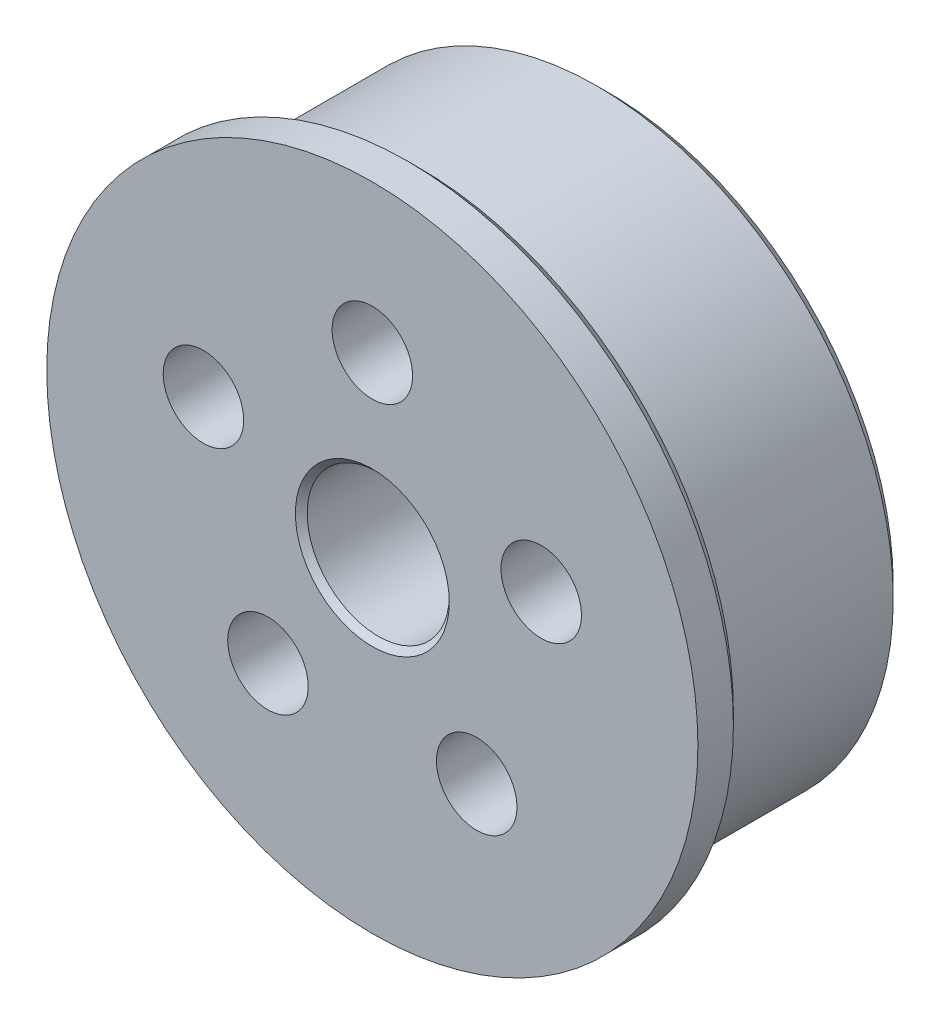
from build123d import *

# Parameters (mm, degrees)
SKETCH_1_R                   = 12.5
SKETCH_1_R_2                 = 1.5
EXTRUDE_1_DEPTH              = 10
EXTRUDE_START                = -2
SKETCH_3_R                   = 13.75
SKETCH_3_R_2                 = 12.5
EXTRUDE_3_DEPTH              = 2
SKETCH_4_R                   = 3
CUT_EXTRUDE_1_DEPTH          = 22.866069606
HOLE_WIZARD_M3_1_D           = 3.4
HOLE_WIZARD_M3_1_CBORE_D     = 7
HOLE_WIZARD_M3_1_CBORE_DEPTH = 4
CHAMFER_1_SIZE               = 0.5
CHAMFER_2_SIZE               = 0.25


with BuildPart() as part:
    # ｽｹｯﾁ1 → ﾎﾞｽ - 押し出し1 (new body)
    with BuildSketch(Plane.XY):
        Circle(SKETCH_1_R)
        with Locations((0, 7.5)):
            Circle(SKETCH_1_R_2, mode=Mode.SUBTRACT)
        with Locations((7.132923872, 2.317627458)):
            Circle(SKETCH_1_R_2, mode=Mode.SUBTRACT)
        with Locations((4.408389392, -6.067627458)):
            Circle(SKETCH_1_R_2, mode=Mode.SUBTRACT)
        with Locations((-4.408389392, -6.067627458)):
            Circle(SKETCH_1_R_2, mode=Mode.SUBTRACT)
        with Locations((-7.132923872, 2.317627458)):
            Circle(SKETCH_1_R_2, mode=Mode.SUBTRACT)
    extrude(amount=EXTRUDE_1_DEPTH)

    # ｽｹｯﾁ3 → ﾎﾞｽ - 押し出し3 (add)
    with BuildSketch(Plane.XY.offset(10).offset(EXTRUDE_START)):
        Circle(SKETCH_3_R)
        Circle(SKETCH_3_R_2, mode=Mode.SUBTRACT)
    extrude(amount=EXTRUDE_3_DEPTH)

    # ｽｹｯﾁ4 → ｶｯﾄ - 押し出し1 (cut, through all)
    with BuildSketch(Plane(origin=(0, 0, 0), x_dir=(-1, 0, 0), z_dir=(0, 0, -1))):
        Circle(SKETCH_4_R)
    extrude(amount=-CUT_EXTRUDE_1_DEPTH, mode=Mode.SUBTRACT)

    # M3 穴付きねじ用座ぐり穴1 (through all)
    with Locations(Plane(origin=(0, 0, 0), x_dir=(-1, 0, 0), z_dir=(0, 0, -1))):
        with Locations((0, 7.5), (7.132923872, 2.317627458), (4.408389392, -6.067627458), (-4.408389392, -6.067627458), (-7.132923872, 2.317627458)):
            CounterBoreHole(HOLE_WIZARD_M3_1_D / 2, HOLE_WIZARD_M3_1_CBORE_D / 2, HOLE_WIZARD_M3_1_CBORE_DEPTH)

    # 面取り1
    chamfer_1_edges = [part.edges().sort_by_distance(p)[0] for p in [
        (-12.5, 0, 0),
        (-13.75, 0, 8),
    ]]
    chamfer(chamfer_1_edges, length=CHAMFER_1_SIZE)

    # 面取り2
    chamfer_2_edges = [part.edges().sort_by_distance(p)[0] for p in [
        (3, 0, 0),
        (3, 0, 10),
        (7.908389392, -6.067627458, 0),
        (-0.908389392, -6.067627458, 0),
        (-3.632923872, 2.317627458, 0),
        (3.5, 7.5, 0),
        (10.632923872, 2.317627458, 0),
    ]]
    chamfer(chamfer_2_edges, length=CHAMFER_2_SIZE)


solid = part.part
